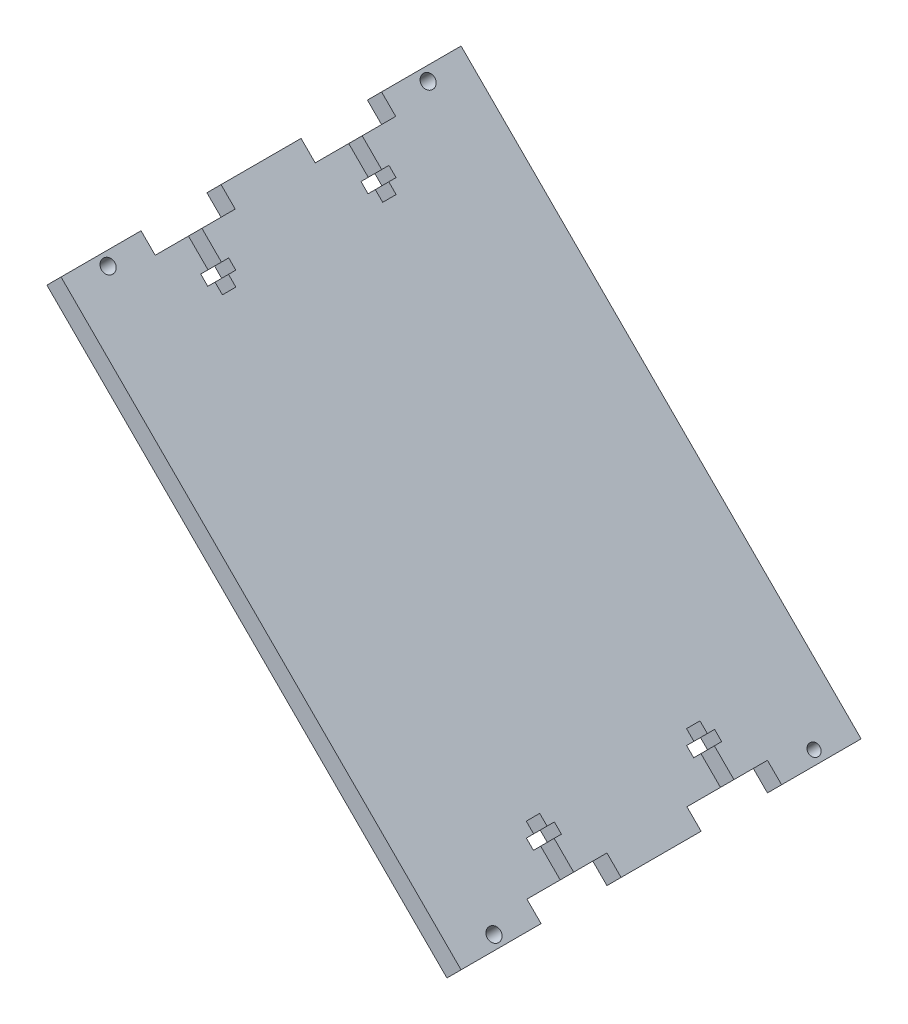
from build123d import *

# Parameters (mm, degrees)
BOSS_EXTRUDE1_DEPTH = 127
SKETCH2_W           = 25.4
SKETCH2_H           = 6.35
SKETCH2_W_2         = 25.559422118
CUT_EXTRUDE1_DEPTH  = 6.35
CUT_EXTRUDE2_DEPTH  = 6.35
SKETCH4_R           = 2.0955
SKETCH4_R_2         = 1.828321723
CUT_EXTRUDE3_DEPTH  = 6.35


with BuildPart() as part:
    # Sketch1 → Boss-Extrude1 (new body)
    with BuildSketch(Plane.XY):
        Polygon((-127, 0), (0, -127), (4.490128061, -122.509871939), (-122.509871939, 4.490128061), align=None)
    extrude(amount=BOSS_EXTRUDE1_DEPTH)

    # Sketch2 → Cut-Extrude1 (cut)
    with BuildSketch(Plane(origin=(-63.5, -63.5, 0), x_dir=(0, 0, 1), z_dir=(-0.7071067811865509, -0.7071067811865441, 0))):
        with Locations((88.9, 86.627561211)):
            Rectangle(SKETCH2_W, SKETCH2_H)
        with Locations((38.020288941, 86.627561211)):
            Rectangle(SKETCH2_W_2, SKETCH2_H)
        with Locations((88.9, -86.627561211)):
            Rectangle(SKETCH2_W, SKETCH2_H)
        with Locations((38.020288941, -86.627561211)):
            Rectangle(SKETCH2_W_2, SKETCH2_H)
    extrude(amount=-CUT_EXTRUDE1_DEPTH, mode=Mode.SUBTRACT)

    # Sketch3 → Cut-Extrude2 (cut)
    with BuildSketch(Plane(origin=(-63.5, -63.5, 0), x_dir=(0, 0, 1), z_dir=(-0.7071067811865509, -0.7071067811865441, 0))):
        Polygon((91.0336, 83.452561211), (86.7664, 83.452561211), (86.7664, 74.689561211), (84.455, 74.689561211), (84.455, 71.514561211), (86.7664, 71.514561211), (86.7664, 68.212561211), (91.0336, 68.212561211), (91.0336, 71.514561211), (93.345, 71.514561211), (93.345, 74.689561211), (91.0336, 74.689561211), align=None)
        Polygon((40.153888941, 83.452561211), (35.886688941, 83.452561211), (35.886688941, 74.689561211), (33.575288941, 74.689561211), (33.575288941, 71.514561211), (35.886688941, 71.514561211), (35.886688941, 68.212561211), (40.153888941, 68.212561211), (40.153888941, 71.514561211), (42.465288941, 71.514561211), (42.465288941, 74.689561211), (40.153888941, 74.689561211), align=None)
        Polygon((86.7664, -83.452561211), (91.0336, -83.452561211), (91.0336, -74.689561211), (93.345, -74.689561211), (93.345, -71.514561211), (91.0336, -71.514561211), (91.0336, -68.212561211), (86.7664, -68.212561211), (86.7664, -71.514561211), (84.455, -71.514561211), (84.455, -74.689561211), (86.7664, -74.689561211), align=None)
        Polygon((35.886688941, -83.452561211), (40.153888941, -83.452561211), (40.153888941, -74.689561211), (42.465288941, -74.689561211), (42.465288941, -71.514561211), (40.153888941, -71.514561211), (40.153888941, -68.212561211), (35.886688941, -68.212561211), (35.886688941, -71.514561211), (33.575288941, -71.514561211), (33.575288941, -74.689561211), (35.886688941, -74.689561211), align=None)
    extrude(amount=-CUT_EXTRUDE2_DEPTH, mode=Mode.SUBTRACT)

    # Sketch4 → Cut-Extrude3 (cut)
    with BuildSketch(Plane(origin=(-59.009871939, -59.009871939, 0), x_dir=(0, 0, -1), z_dir=(0.707106781186551, 0.7071067811865441, 0))):
        with Locations((-114.3, 86.627561211)):
            Circle(SKETCH4_R)
        with Locations((-12.7, 86.627561211)):
            Circle(SKETCH4_R)
        with Locations((-12.7, -86.627561211)):
            Circle(SKETCH4_R_2)
        with Locations((-114.3, -86.627561211)):
            Circle(SKETCH4_R)
    extrude(amount=-CUT_EXTRUDE3_DEPTH, mode=Mode.SUBTRACT)


solid = part.part
